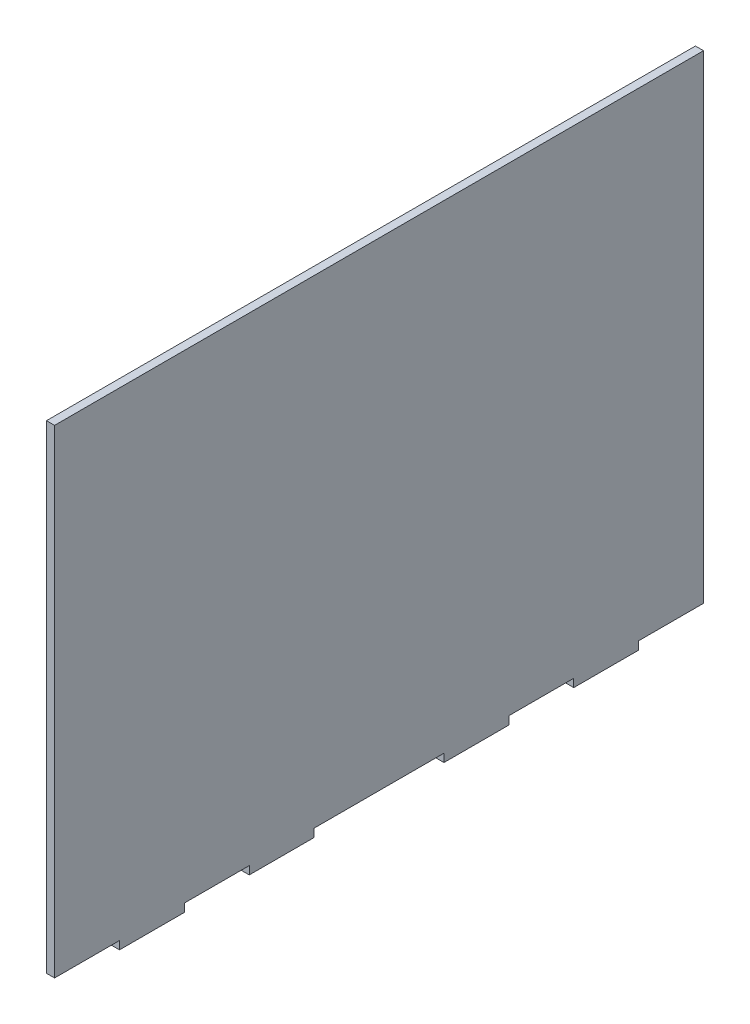
from build123d import *

# Parameters (mm, degrees)
SKIZZE1_W                       = 400
SKIZZE1_H                       = 300
AUFSATZ_LINEAR_AUSTRAGEN1_DEPTH = 5
SKIZZE2_W                       = 40
SKIZZE2_H                       = 5
SKIZZE2_W_2                     = 80
SCHNITT_LINEAR_AUSTRAGEN1_DEPTH = 361.589794642


with BuildPart() as part:
    # Skizze1 → Aufsatz-Linear austragen1 (new body)
    with BuildSketch(Plane(origin=(0, 0, 0), x_dir=(0, 0, -1), z_dir=(1, 0, 0))):
        with Locations((0, 150)):
            Rectangle(SKIZZE1_W, SKIZZE1_H)
    extrude(amount=AUFSATZ_LINEAR_AUSTRAGEN1_DEPTH)

    # Skizze2 → Schnitt-Linear austragen1 (cut, through all)
    with BuildSketch(Plane(origin=(5, 0, 0), x_dir=(0, 0, -1), z_dir=(1, 0, 0))):
        with Locations((-180, 2.5)):
            Rectangle(SKIZZE2_W, SKIZZE2_H)
        with Locations((-100, 2.5)):
            Rectangle(SKIZZE2_W, SKIZZE2_H)
        with Locations((0, 2.5)):
            Rectangle(SKIZZE2_W_2, SKIZZE2_H)
        with Locations((100, 2.5)):
            Rectangle(SKIZZE2_W, SKIZZE2_H)
        with Locations((180, 2.5)):
            Rectangle(SKIZZE2_W, SKIZZE2_H)
    extrude(amount=-SCHNITT_LINEAR_AUSTRAGEN1_DEPTH, mode=Mode.SUBTRACT)


solid = part.part
